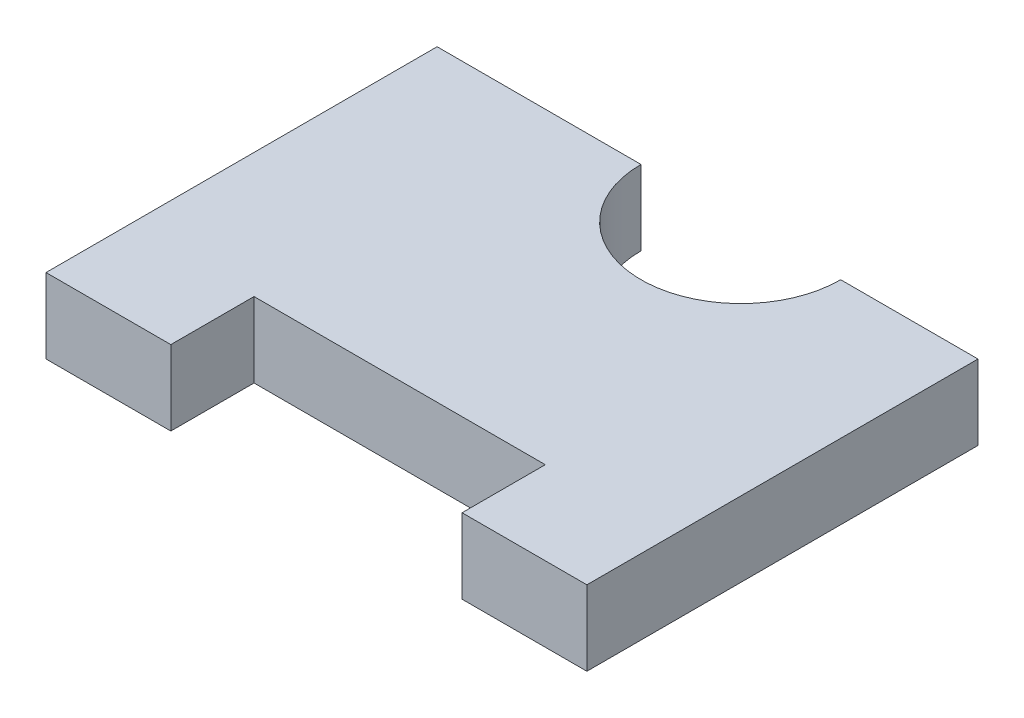
from build123d import *

# Parameters (mm, degrees)
BOSS_EXTRUDE1_DEPTH = 1.8


with BuildPart() as part:
    # Sketch1 → Boss-Extrude1 (new body)
    with BuildSketch(Plane(origin=(0, 0, 0), x_dir=(1, 0, 0), z_dir=(0, 1, 0))):
        with BuildLine():
            Line((6.5, 5), (6.5, 0))
            Line((6.5, 0), (6.5, -2))
            Line((6.5, -2), (3.5, -2))
            Line((3.5, -2), (3.5, 0))
            Line((3.5, 0), (-3.5, 0))
            Line((-3.5, 0), (-3.5, -2))
            Line((-3.5, -2), (-6.5, -2))
            Line((-6.5, -2), (-6.5, 0))
            Line((-6.5, 0), (-6.5, 5))
            Line((-6.5, 5), (-6.5, 7.4))
            Line((-6.5, 7.4), (-1.6, 7.4))
            ThreePointArc((-1.6, 7.4), (0.8, 5), (3.2, 7.4))
            Line((3.2, 7.4), (6.5, 7.4))
            Line((6.5, 7.4), (6.5, 5))
        make_face()
    extrude(amount=BOSS_EXTRUDE1_DEPTH)


solid = part.part
